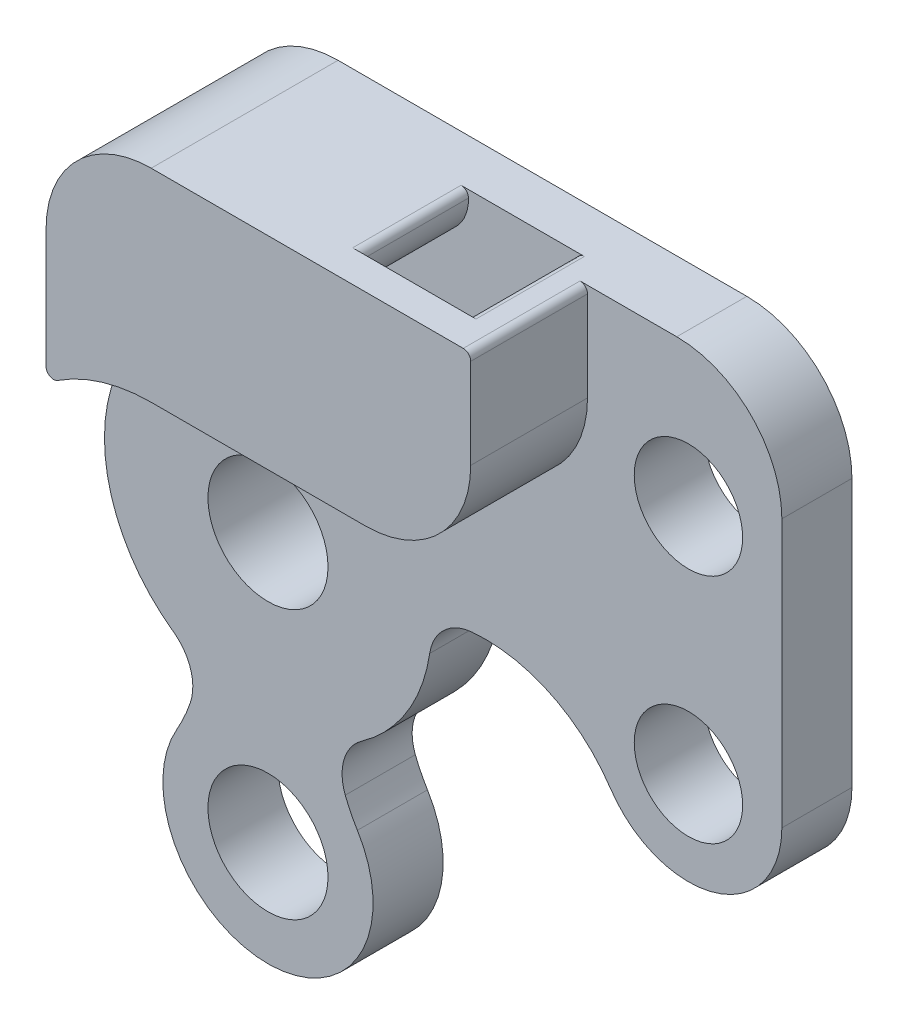
from build123d import *
from build123d.topology import SkipClean

# Parameters (mm, degrees)
SKETCH2_R                 = 2.0399375
SKETCH2_R_2               = 1.8415
BOSS_EXTRUDE1_DEPTH       = 4.7625
CUT_EXTRUDE1_START        = -3.175
SKETCH5_R                 = 2.0399375
SKETCH5_R_2               = 1.8415
CUT_EXTRUDE1_DEPTH        = 3.175
CUT_EXTRUDE2_START        = 0.79375
CUT_EXTRUDE2_DEPTH        = 3.683
BOSS_EXTRUDE2_START       = 1.5875
SKETCH6_R                 = 3.571875
SKETCH6_R_2               = 2.0399375
BOSS_EXTRUDE2_DEPTH       = 1.5875
BOSS_EXTRUDE3_OUTLINE_R   = 2.0399375
BOSS_EXTRUDE3_OUTLINE_R_2 = 1.8415
BOSS_EXTRUDE3_OUTLINE_R_3 = 3.571875
BOSS_EXTRUDE3_DEPTH       = 0.79375
BOSS_EXTRUDE4_DEPTH       = 0.79375
FILLET1_R                 = 3.572002
FILLET2_R                 = 0.254
FILLET3_R                 = 1.5875


# Read off the part's stored shape, not the designer's step: Boss-Extrude3
with BuildPart() as part:
    # Sketch2 → Boss-Extrude1 (new body)
    with BuildSketch(Plane.XY):
        with BuildLine():
            Line((17.462464722, 12.698349), (0, 12.698349))
            ThreePointArc((0, 12.698349), (-2.525697034, 11.652171034), (-3.571875, 9.126474))
            Line((-3.571875, 9.126474), (-3.571875, 4.256010226))
            ThreePointArc((-3.571875, 4.256010226), (-5.510115516, -0.714521565), (-2.368197689, -5.02628628))
            ThreePointArc((-2.368197689, -5.02628628), (-2.602783662, -6.224309717), (-3.093334465, -7.342187459))
            ThreePointArc((-3.093334465, -7.342187459), (0.053006227, -12.699606675), (3.038971631, -7.251174697))
            ThreePointArc((3.038971631, -7.251174697), (2.543740299, -6.196888698), (2.299944817, -5.05788176))
            ThreePointArc((2.299944817, -5.05788176), (4.727286579, -2.919704723), (5.552352254, 0.208082946))
            ThreePointArc((5.552352254, 0.208082946), (8.938780729, 0.309264009), (11.645223776, -1.728701017))
            ThreePointArc((11.645223776, -1.728701017), (15.207114111, -3.007142891), (17.462464722, 0.03175))
            Line((17.462464722, 0.03175), (17.462464722, 12.698349))
        make_face()
        with Locations((0, -9.128125)):
            Circle(SKETCH2_R, mode=Mode.SUBTRACT)
        Circle(SKETCH2_R, mode=Mode.SUBTRACT)
        with Locations((14.287464722, 0.03175)):
            Circle(SKETCH2_R_2, mode=Mode.SUBTRACT)
        with Locations((14.287464722, 7.90575)):
            Circle(SKETCH2_R_2, mode=Mode.SUBTRACT)
    extrude(amount=BOSS_EXTRUDE1_DEPTH)

    # Sketch5 → Cut-Extrude1 (cut)
    with BuildSketch(Plane.XY.offset(4.7625).offset(CUT_EXTRUDE1_START)):
        with BuildLine():
            Line((10.858464722, 12.698349), (10.858464722, 11.08075))
            Line((10.858464722, 11.08075), (10.858464722, 5.81025))
            Line((10.858464722, 5.81025), (0, 5.81025))
            ThreePointArc((0, 5.81025), (-1.88847054, 5.494786991), (-3.571875, 4.582653603))
            Line((-3.571875, 4.582653603), (-3.571875, 4.256010226))
            ThreePointArc((-3.571875, 4.256010226), (-5.510115516, -0.714521565), (-2.368197689, -5.02628628))
            ThreePointArc((-2.368197689, -5.02628628), (-2.602783664, -6.224309725), (-3.093334473, -7.342187472))
            ThreePointArc((-3.093334473, -7.342187472), (0.053006235, -12.699606675), (3.038971631, -7.251174697))
            ThreePointArc((3.038971631, -7.251174697), (2.543740299, -6.196888698), (2.299944817, -5.05788176))
            ThreePointArc((2.299944817, -5.05788176), (4.727286579, -2.919704723), (5.552352254, 0.208082946))
            ThreePointArc((5.552352254, 0.208082946), (8.938780739, 0.309264006), (11.645223789, -1.728701036))
            ThreePointArc((11.645223801, -1.728701054), (15.207114132, -3.007142884), (17.462464722, 0.03175))
            Line((17.462464722, 0.03175), (17.462464722, 12.698349))
            Line((17.462464722, 12.698349), (10.858464722, 12.698349))
        make_face()
        with Locations((0, -9.128125)):
            Circle(SKETCH5_R, mode=Mode.SUBTRACT)
        Circle(SKETCH5_R, mode=Mode.SUBTRACT)
        with Locations((14.287464722, 0.03175)):
            Circle(SKETCH5_R_2, mode=Mode.SUBTRACT)
        with Locations((14.287464722, 7.90575)):
            Circle(SKETCH5_R_2, mode=Mode.SUBTRACT)
    extrude(amount=CUT_EXTRUDE1_DEPTH, mode=Mode.SUBTRACT)

    # Sketch3 → Cut-Extrude2 (cut)
    with BuildSketch(Plane.XY.offset(CUT_EXTRUDE2_START)):
        with BuildLine():
            Line((-0.364938051, 10.967974), (-3.571875, 10.967974))
            Line((-3.571875, 10.967974), (-3.571875, 7.284974))
            Line((-3.571875, 7.284974), (4.564044861, 7.284974))
            ThreePointArc((4.564044861, 7.284974), (1.487546789, 8.307421556), (-0.364938051, 10.967974))
        make_face()
        with BuildLine():
            Line((4.564044861, 10.967974), (-0.364938051, 10.967974))
            ThreePointArc((-0.364938051, 10.967974), (1.487546789, 8.307421556), (4.564044861, 7.284974))
            Line((4.564044861, 7.284974), (4.564044861, 10.967974))
        make_face()
        with BuildLine():
            ThreePointArc((6.020789845, 12.424718984), (5.594119118, 11.394644727), (4.564044861, 10.967974))
            Line((4.564044861, 10.967974), (4.564044861, 7.284974))
            ThreePointArc((4.564044861, 7.284974), (8.198393393, 8.790370452), (9.703789845, 12.424718984))
            ThreePointArc((9.703789845, 12.424718984), (9.701967288, 12.561582524), (9.696500912, 12.698349))
            Line((9.696500912, 12.698349), (5.99486021, 12.698349))
            ThreePointArc((5.99486021, 12.698349), (6.014292948, 12.562146903), (6.020789845, 12.424718984))
        make_face()
    extrude(amount=CUT_EXTRUDE2_DEPTH, mode=Mode.SUBTRACT)

    # Sketch6 → Boss-Extrude2 (add)
    with SkipClean():  # the faces are left unmerged after this step: merging them gives an invalid solid
        with BuildSketch(Plane(origin=(0, 0, 0), x_dir=(-1, 0, 0), z_dir=(0, 0, -1)).offset(BOSS_EXTRUDE2_START)):
            with Locations(Location((0, 0, 0), (0, 0, 180))):
                Circle(SKETCH6_R)
            Circle(SKETCH6_R_2, mode=Mode.SUBTRACT)
        extrude(amount=-BOSS_EXTRUDE2_DEPTH)

    # Boss-Extrude3 outline → Boss-Extrude3 (add)
    with BuildSketch(Plane(origin=(0, 0, 0), x_dir=(-1, 0, 0), z_dir=(0, 0, -1))):
        with BuildLine():
            ThreePointArc((3.093334489, -7.3421875), (2.602783669, -6.22430974), (2.368197689, -5.02628628))
            ThreePointArc((2.368197689, -5.02628628), (5.510115516, -0.714521565), (3.571875, 4.256010226))
            Line((3.571875, 4.256010226), (3.571875, 9.126474))
            ThreePointArc((3.571875, 9.126474), (2.525697034, 11.652171034), (0, 12.698349))
            Line((0, 12.698349), (-17.462464722, 12.698349))
            Line((-17.462464722, 12.698349), (-17.462464722, 0.03175))
            ThreePointArc((-17.462464722, 0.03175), (-15.207114132, -3.007142884), (-11.645223801, -1.728701054))
            ThreePointArc((-11.645223801, -1.728701054), (-8.93878075, 0.309264003), (-5.552352254, 0.208082946))
            ThreePointArc((-5.552352254, 0.208082946), (-4.727286579, -2.919704723), (-2.299944817, -5.05788176))
            ThreePointArc((-2.299944817, -5.05788176), (-2.543739786, -6.196887176), (-3.038969943, -7.251171964))
            ThreePointArc((-3.038969943, -7.251171964), (-0.053007857, -12.699606651), (3.093334489, -7.3421875))
        make_face()
        with Locations((0, -9.128125)):
            Circle(BOSS_EXTRUDE3_OUTLINE_R, mode=Mode.SUBTRACT)
        with Locations((-14.287464722, 0.03175)):
            Circle(BOSS_EXTRUDE3_OUTLINE_R_2, mode=Mode.SUBTRACT)
        with Locations((-14.287464722, 7.90575)):
            Circle(BOSS_EXTRUDE3_OUTLINE_R_2, mode=Mode.SUBTRACT)
        Circle(BOSS_EXTRUDE3_OUTLINE_R_3, mode=Mode.SUBTRACT)
    extrude(amount=BOSS_EXTRUDE3_DEPTH)

    # Sketch8 → Boss-Extrude4 (add)
    with BuildSketch(Plane.XY.offset(4.7625)):
        with BuildLine():
            Line((-3.571875, 9.126474), (-3.571875, 4.582653603))
            ThreePointArc((-3.571875, 4.582653603), (-1.88847054, 5.494786991), (0, 5.81025))
            Line((0, 5.81025), (10.858464722, 5.81025))
            Line((10.858464722, 5.81025), (10.858464722, 12.698349))
            Line((10.858464722, 12.698349), (0, 12.698349))
            ThreePointArc((0, 12.698349), (-2.525697034, 11.652171034), (-3.571875, 9.126474))
        make_face()
    extrude(amount=BOSS_EXTRUDE4_DEPTH)

    # Fillet1
    fillet1_edges = [part.edges().sort_by_distance(p)[0] for p in [
        (17.462464722, 12.698349, 0.79375),
        (10.858464722, 5.81025, 3.571875),
    ]]
    fillet(fillet1_edges, radius=FILLET1_R)

    # Fillet2
    fillet2_edges = [part.edges().sort_by_distance(p)[0] for p in [
        (-3.060583076, 10.967974, 2.63525),
        (-3.571875, 7.284974, 2.63525),
        (9.696500912, 12.698349, 2.63525),
        (5.99486021, 12.698349, 2.63525),
        (10.858464722, 12.698349, 3.571875),
        (-3.571875, 4.582653603, 3.571875),
    ]]
    fillet(fillet2_edges, radius=FILLET2_R)

    # Fillet3
    fillet3_edges = [part.edges().sort_by_distance(p)[0] for p in [
        (5.552352254, 0.208082946, 0.79375),
        (2.299944817, -5.05788176, 0.79375),
        (-2.368197689, -5.02628628, 0.79375),
        (-3.571875, 4.256010226, 0.79375),
    ]]
    fillet(fillet3_edges, radius=FILLET3_R)


solid = part.part
